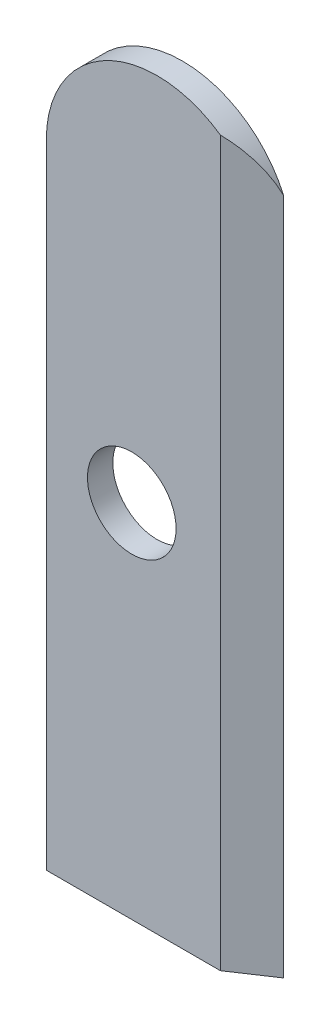
from build123d import *

# Parameters (mm, degrees)
BOSS_EXTRUDE1_DEPTH = 0.8
CHAMFER1_SIZE       = 1.2
CHAMFER1_SIZE_2     = 0.8
CUT_EXTRUDE1_REACH  = 26.533
SKETCH5_R           = 1.4


with BuildPart() as part:
    # Sketch2 → Boss-Extrude1 (new body)
    with BuildSketch(Plane.XY):
        with BuildLine():
            Line((-7, 0), (-0.3, 0))
            Line((-0.3, 0), (-0.3, 20))
            Line((-0.3, 20), (-0.3, 21.417744688))
            ThreePointArc((-0.3, 21.417744688), (-4.224568837, 23.424178734), (-7, 20))
            Line((-7, 20), (-7, 0))
        make_face()
    extrude(amount=BOSS_EXTRUDE1_DEPTH)

    # Chamfer1
    # the kernel refuses this chamfer: 1.2, 0.8 mm, written as the material it takes off along each edge
    with BuildSketch(Plane(origin=(-0.3, 24.518305317, 0.8), x_dir=(-0.9997695277037822, 0, 0.021468383147227363), z_dir=(0, -1, 0))) as chamfer1_piece_1:
        Polygon((CHAMFER1_SIZE * 0.999769527704, CHAMFER1_SIZE * 0.0214683831472), (-CHAMFER1_SIZE_2 * 0.0214683831472, CHAMFER1_SIZE_2 * 0.999769527704), (0, 0), align=None)
    extrude(amount=27.618865945, mode=Mode.SUBTRACT)

    # Sketch5 → Cut-Extrude1 (cut, up to next)
    with BuildSketch(Plane.XY.offset(0.8), mode=Mode.PRIVATE) as cut_extrude1_sk1:
        with Locations((-4.3, 11.4)):
            Circle(SKETCH5_R)
    cut_extrude1_tool1 = extrude(cut_extrude1_sk1.sketch, amount=-CUT_EXTRUDE1_REACH, mode=Mode.PRIVATE) & part.part
    add(cut_extrude1_tool1.solids().sort_by_distance((-4.3, 11.4, 0.8))[0], mode=Mode.SUBTRACT)


solid = part.part
